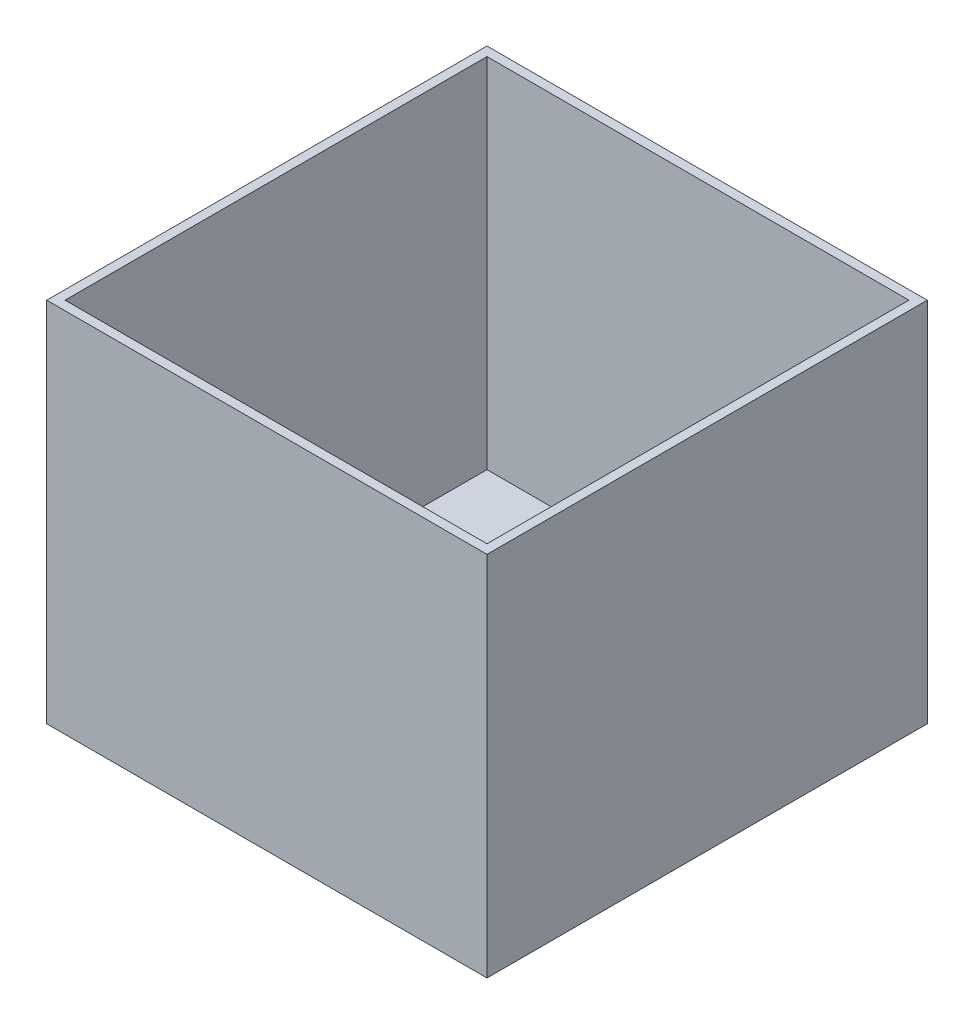
from build123d import *

# Parameters (mm, degrees)
SKETCH2_W           = 240
SKETCH2_H           = 240
BOSS_EXTRUDE1_DEPTH = 200
SKETCH17_W          = 230
SKETCH17_H          = 230
CUT_EXTRUDE1_DEPTH  = 195


with BuildPart() as part:
    # Sketch2 → Boss-Extrude1 (new body)
    with BuildSketch(Plane(origin=(0, -113.102021597, 0), x_dir=(1, 0, 0), z_dir=(0, 1, 0))):
        Rectangle(SKETCH2_W, SKETCH2_H)
    extrude(amount=BOSS_EXTRUDE1_DEPTH)

    # Sketch17 → Cut-Extrude1 (cut)
    with BuildSketch(Plane(origin=(0, 86.897978403, 0), x_dir=(1, 0, 0), z_dir=(0, 1, 0))):
        Rectangle(SKETCH17_W, SKETCH17_H)
    extrude(amount=-CUT_EXTRUDE1_DEPTH, mode=Mode.SUBTRACT)


solid = part.part
